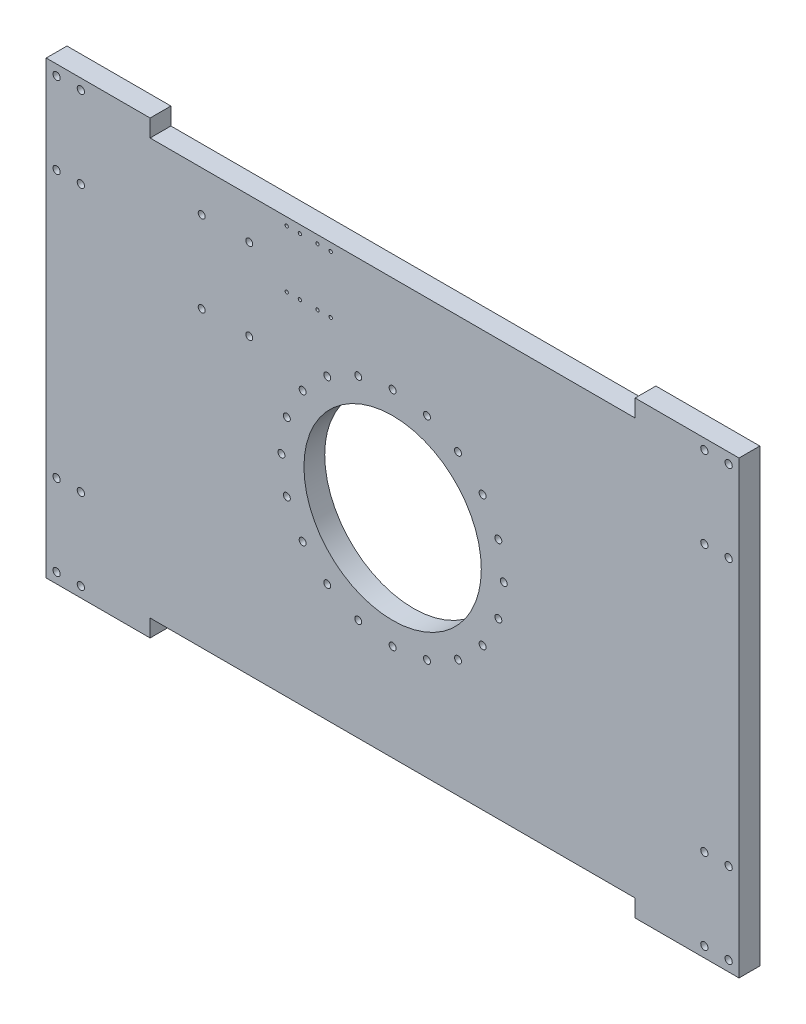
from build123d import *

# Parameters (mm, degrees)
ESQUISSE1_R                  = 10.5
BOSS_EXTRU_1_DEPTH           = 60
ESQUISSE2_R                  = 256
ENL_V_MAT_EXTRU_1_DEPTH      = 1602.905115792
ESQUISSE5_R                  = 10
ENL_V_MAT_EXTRU_3_DEPTH      = 1602.905115792
R_P_TITION_CIRCULAIRE1_COUNT = 20
ENL_V_MAT_EXTRU_5_DEPTH      = 1602.905115792
ENL_V_MAT_EXTRU_5_DEPTH_BACK = 100
ESQUISSE11_R                 = 10
ESQUISSE12_R                 = 4.7625
ESQUISSE12_R_2               = 4.764130996
ENL_V_MAT_EXTRU_6_DEPTH      = 100
ESQUISSE15_R                 = 10.5
ENL_V_MAT_EXTRU_7_DEPTH      = 110
ESQUISSE16_R                 = 10.5
ENL_V_MAT_EXTRU_8_DEPTH      = 110


with BuildPart() as part:
    # Esquisse1 → Boss.-Extru.1 (new body)
    with BuildSketch(Plane.XY):
        Polygon((-1000, 1250), (-700, 1250), (-700, 1200), (700, 1200), (700, 1250), (1000, 1250), (1000, -50), (700, -50), (700, 0), (-700, 0), (-700, -50), (-1000, -50), align=None)
        with Locations((-970, -20)):
            Circle(ESQUISSE1_R, mode=Mode.SUBTRACT)
        with Locations((-970, 215)):
            Circle(ESQUISSE1_R, mode=Mode.SUBTRACT)
        with Locations((-900, 215)):
            Circle(ESQUISSE1_R, mode=Mode.SUBTRACT)
        with Locations((-900, -20)):
            Circle(ESQUISSE1_R, mode=Mode.SUBTRACT)
    extrude(amount=BOSS_EXTRU_1_DEPTH)

    # Esquisse2 → Enlèv. mat.-Extru.1 (cut, through all)
    with BuildSketch(Plane.XY.offset(60)):
        with Locations((0, 600)):
            Circle(ESQUISSE2_R)
    extrude(amount=-ENL_V_MAT_EXTRU_1_DEPTH, mode=Mode.SUBTRACT)

    # Esquisse5 → Enlèv. mat.-Extru.3 (cut, through all)
    with BuildSketch(Plane.XY):
        with Locations((0, 921)):
            Circle(ESQUISSE5_R)
    enl_v_mat_extru_3 = extrude(amount=ENL_V_MAT_EXTRU_3_DEPTH, mode=Mode.SUBTRACT)

    # Répétition circulaire1: Enlèv. mat.-Extru.3 ×20 about axis
    r_p_tition_circulaire1_axis = Axis((0, 600, 0), (0, 0, -1))
    for i in range(1, R_P_TITION_CIRCULAIRE1_COUNT):
        add(enl_v_mat_extru_3.rotate(r_p_tition_circulaire1_axis, i * 360 / R_P_TITION_CIRCULAIRE1_COUNT), mode=Mode.SUBTRACT)

    # Esquisse11 → Enlèv. mat.-Extru.5 (cut, two sides: drawn at the far end of the back side and taken through both)
    with BuildSketch(Plane(origin=(0, 0, 0), x_dir=(-1, 0, 0), z_dir=(0, 0, -1)).offset(-ENL_V_MAT_EXTRU_5_DEPTH_BACK)):
        with Locations((413.85, 847.499999527)):
            Circle(ESQUISSE11_R)
        with Locations((551.15, 847.499999527)):
            Circle(ESQUISSE11_R)
        with Locations((551.15, 1082.5)):
            Circle(ESQUISSE11_R)
        with Locations((413.85, 1082.5)):
            Circle(ESQUISSE11_R)
    extrude(amount=ENL_V_MAT_EXTRU_5_DEPTH + ENL_V_MAT_EXTRU_5_DEPTH_BACK, mode=Mode.SUBTRACT)

    # Esquisse12 → Enlèv. mat.-Extru.6 (cut)
    with BuildSketch(Plane(origin=(0, 0, 0), x_dir=(-1, 0, 0), z_dir=(0, 0, -1))):
        with Locations((178.748120078, 1177.125064527)):
            Circle(ESQUISSE12_R)
        with Locations((267.648120078, 1177.125064527)):
            Circle(ESQUISSE12_R)
        with Locations((178.748120078, 1012.025064527)):
            Circle(ESQUISSE12_R)
        with Locations((216.848120078, 1012.025064527)):
            Circle(ESQUISSE12_R)
        with Locations((267.648120078, 1012.025064527)):
            Circle(ESQUISSE12_R_2)
        with Locations((305.748120078, 1012.025064527)):
            Circle(ESQUISSE12_R)
        with Locations((305.748120078, 1177.125064527)):
            Circle(ESQUISSE12_R)
        with Locations((216.848120078, 1177.125064527)):
            Circle(ESQUISSE12_R)
    extrude(amount=-ENL_V_MAT_EXTRU_6_DEPTH, mode=Mode.SUBTRACT)

    # Esquisse15 → Enlèv. mat.-Extru.7 (cut)
    with BuildSketch(Plane(origin=(0, 0, 0), x_dir=(-1, 0, 0), z_dir=(0, 0, -1))):
        with Locations((970, 1220)):
            Circle(ESQUISSE15_R)
        with Locations((970, 985)):
            Circle(ESQUISSE15_R)
        with Locations((900, 985)):
            Circle(ESQUISSE15_R)
        with Locations((900, 1220)):
            Circle(ESQUISSE15_R)
    enl_v_mat_extru_7 = extrude(amount=-ENL_V_MAT_EXTRU_7_DEPTH, mode=Mode.SUBTRACT)

    # Symétrie1: Enlèv. mat.-Extru.7 across plane
    add(enl_v_mat_extru_7.mirror(Plane(origin=(0, 0, 0), x_dir=(0, 0, 1), z_dir=(1, 0, 0))), mode=Mode.SUBTRACT)

    # Esquisse16 → Enlèv. mat.-Extru.8 (cut)
    with BuildSketch(Plane(origin=(0, 0, 0), x_dir=(-1, 0, 0), z_dir=(0, 0, -1))):
        with Locations((-970, -20)):
            Circle(ESQUISSE16_R)
        with Locations((-900, -20)):
            Circle(ESQUISSE16_R)
        with Locations((-900, 215)):
            Circle(ESQUISSE16_R)
        with Locations((-970, 215)):
            Circle(ESQUISSE16_R)
    extrude(amount=-ENL_V_MAT_EXTRU_8_DEPTH, mode=Mode.SUBTRACT)


solid = part.part
